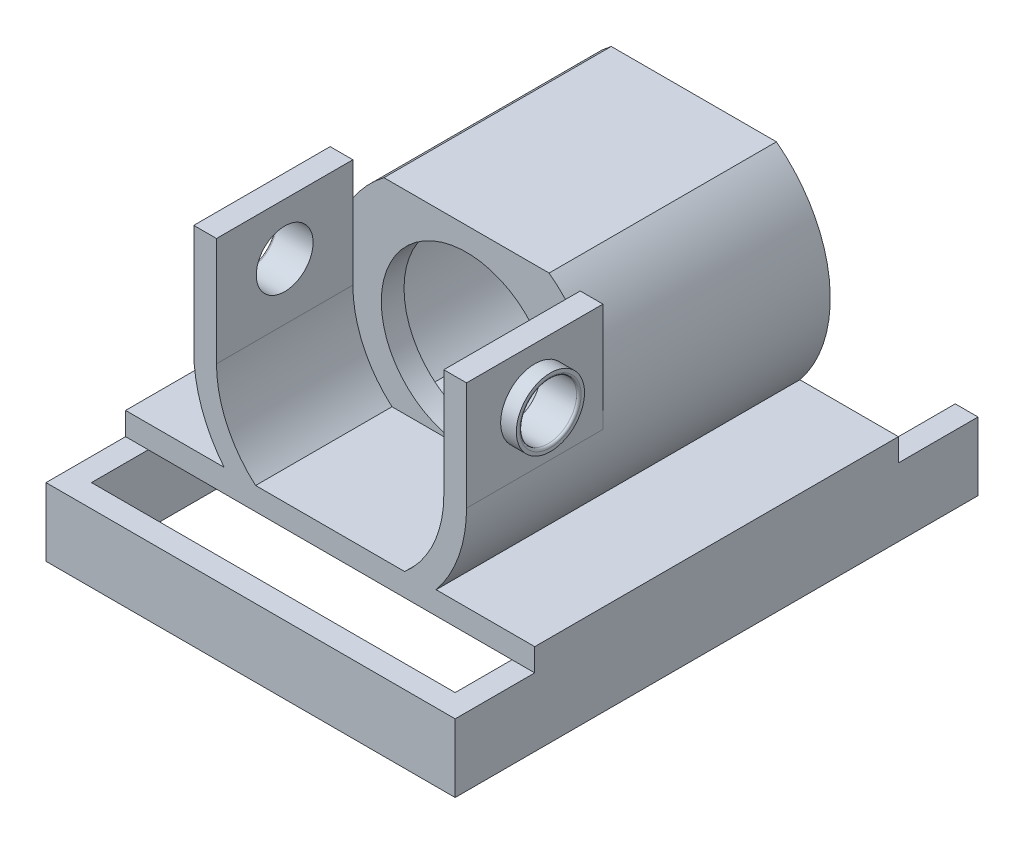
from build123d import *

# Parameters (mm, degrees)
EXTRUDE1_START     = 7
EXTRUDE1_DEPTH     = 20
SKETCH2_R          = 7.5
CUT_EXTRUDE1_DEPTH = 2
SHELL1_START       = 7
SHELL1_DEPTH       = 18
EXTRUDE2_DEPTH     = 12
SKETCH9_R          = 3
EXTRUDE4_DEPTH     = 1.38
SKETCH10_R         = 2.5
CUT_EXTRUDE3_DEPTH = 49.252462113
FILLET1_R          = 0.2
SKETCH11_W         = 36
SKETCH11_H         = 46
SKETCH11_W_2       = 32
SKETCH11_H_2       = 42
EXTRUDE5_DEPTH     = 6
SKETCH12_W         = 32
SKETCH12_H         = 8.201060756
CUT_EXTRUDE4_DEPTH = 2
SKETCH13_W         = 36
SKETCH13_H         = 32
EXTRUDE6_DEPTH     = 2


# Read off the part's stored shape, not the designer's step: Shell1
with BuildPart() as part:
    # Sketch1 → Extrude1 (new body)
    with BuildSketch(Plane.XY.offset(EXTRUDE1_START)):
        with BuildLine():
            Line((-7.266188822, -9.55), (7.266188822, -9.55))
            ThreePointArc((7.266188822, -9.55), (12, 0), (7.266188822, 9.55))
            Line((7.266188822, 9.55), (-7.266188822, 9.55))
            ThreePointArc((-7.266188822, 9.55), (-12, 0), (-7.266188822, -9.55))
        make_face()
    extrude(amount=EXTRUDE1_DEPTH)

    # Sketch2 → Cut-Extrude1 (cut)
    with BuildSketch(Plane.XY.offset(27)):
        Circle(SKETCH2_R)
    extrude(amount=-CUT_EXTRUDE1_DEPTH, mode=Mode.SUBTRACT)

    # Shell1 outline → Shell1 (cut)
    with BuildSketch(Plane.XY.offset(SHELL1_START)):
        with BuildLine():
            Line((6.557247898, 7.55), (-6.557247898, 7.55))
            ThreePointArc((-6.557247898, 7.55), (-10, 0), (-6.557247898, -7.55))
            Line((-6.557247898, -7.55), (6.557247898, -7.55))
            ThreePointArc((6.557247898, -7.55), (10, 0), (6.557247898, 7.55))
        make_face()
    extrude(amount=SHELL1_DEPTH, mode=Mode.SUBTRACT)

    # Sketch5 → Extrude2 (add)
    with BuildSketch(Plane.XY.offset(27)):
        with BuildLine():
            Line((-7.266188822, -9.55), (7.266188822, -9.55))
            ThreePointArc((7.266188822, -9.55), (10.751610713, -5.329434029), (12, 0))
            Line((12, 0), (12, 9.55))
            Line((12, 9.55), (10, 9.55))
            Line((10, 9.55), (10, 0))
            ThreePointArc((10, 0), (9.098694384, -4.148946916), (6.557247898, -7.55))
            Line((6.557247898, -7.55), (-6.557247898, -7.55))
            ThreePointArc((-6.557247898, -7.55), (-9.098694384, -4.148946916), (-10, 0))
            Line((-10, 0), (-10, 9.55))
            Line((-10, 9.55), (-12, 9.55))
            Line((-12, 9.55), (-12, 0))
            ThreePointArc((-12, 0), (-10.751610713, -5.329434029), (-7.266188822, -9.55))
        make_face()
    extrude(amount=EXTRUDE2_DEPTH)

    # Sketch9 → Extrude4 (add)
    with BuildSketch(Plane(origin=(12, 0, 0), x_dir=(0, 0, -1), z_dir=(1, 0, 0))):
        with Locations(Location((-33, 5, 0), (0, 0, 180))):
            Circle(SKETCH9_R)
    extrude4 = extrude(amount=EXTRUDE4_DEPTH)

    # Mirror2: Extrude4 across plane
    add(extrude4.mirror(Plane(origin=(0, 0, 0), x_dir=(0, 0, 1), z_dir=(1, 0, 0))))

    # Sketch10 → Cut-Extrude3 (cut, through all)
    with BuildSketch(Plane(origin=(13.38, 0, 0), x_dir=(0, 0, -1), z_dir=(1, 0, 0))):
        with Locations((-33, 5)):
            Circle(SKETCH10_R)
    extrude(amount=-CUT_EXTRUDE3_DEPTH, mode=Mode.SUBTRACT)

    # Fillet1
    fillet1_edges = [part.edges().sort_by_distance(p)[0] for p in [
        (-13.38, 5, 35.5),
        (13.38, 5, 35.5),
    ]]
    fillet(fillet1_edges, radius=FILLET1_R)



with BuildPart() as body_2:
    # Sketch11 → Extrude5 (new body)
    with BuildSketch(Plane.XZ.offset(9.55)):
        with Locations((0, 23)):
            Rectangle(SKETCH11_W, SKETCH11_H)
        with Locations((0, 23)):
            Rectangle(SKETCH11_W_2, SKETCH11_H_2, mode=Mode.SUBTRACT)
    extrude(amount=EXTRUDE5_DEPTH)

    # Sketch12 → Cut-Extrude4 (cut)
    with BuildSketch(Plane(origin=(0, 0, 0), x_dir=(-1, 0, 0), z_dir=(0, 0, -1))):
        with Locations((0, -12.325842128)):
            Rectangle(SKETCH12_W, SKETCH12_H)
    extrude(amount=-CUT_EXTRUDE4_DEPTH, mode=Mode.SUBTRACT)


with BuildPart() as part_1:
    add(part.part)

    add(body_2.part)  # Extrude6 merges body 2
    # Sketch13 → Extrude6 (add)
    with BuildSketch(Plane.XZ.offset(9.55)):
        with Locations((0, 23)):
            Rectangle(SKETCH13_W, SKETCH13_H)
    extrude(amount=-EXTRUDE6_DEPTH)


solid = part_1.part
